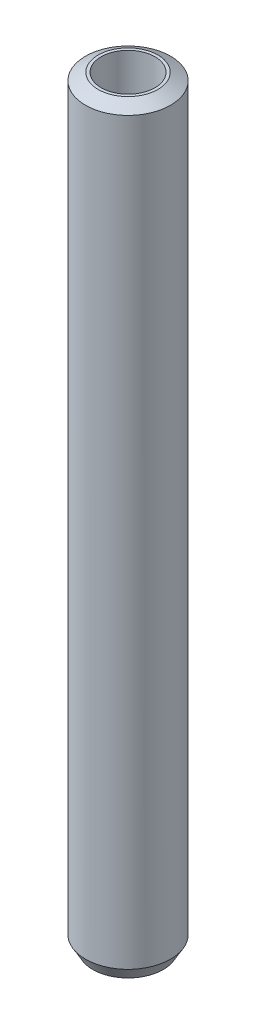
from build123d import *
from OCP.BRepFilletAPI import BRepFilletAPI_MakeChamfer

# Parameters (mm, degrees)
SKETCH1_R           = 25
BOSS_EXTRUDE1_DEPTH = 446.381429331
SKETCH2_R           = 15.813648109
CUT_EXTRUDE1_DEPTH  = 448.77938815
CHAMFER1_SIZE       = 4.301810032
CHAMFER1_SIZE2      = 7.450953539


with BuildPart() as part:
    # Sketch1 → Boss-Extrude1 (new body)
    with BuildSketch(Plane(origin=(0, 0, 0), x_dir=(1, 0, 0), z_dir=(0, 1, 0))):
        Circle(SKETCH1_R)
    extrude(amount=BOSS_EXTRUDE1_DEPTH)

    # Sketch2 → Cut-Extrude1 (cut, through all)
    with BuildSketch(Plane(origin=(0, 0, 0), x_dir=(1, 0, 0), z_dir=(0, 1, 0))):
        Circle(SKETCH2_R)
    extrude(amount=CUT_EXTRUDE1_DEPTH, mode=Mode.SUBTRACT)

    # Chamfer1: one chamfer whose edges measure the first distance from different faces: ONE call of the kernel's chamfer builder (chamfer() names one face for all edges)
    chamfer1_edges_1 = [part.edges().sort_by_distance(p)[0] for p in [
        (-25, 446.381429331, 0),
    ]]
    chamfer1_side_1 = [part.faces().sort_by_distance(p)[0] for p in [
        (-25, 223.190714666, 0),
    ]]
    chamfer1_edges_2 = [part.edges().sort_by_distance(p)[0] for p in [
        (-25, 0, 0),
    ]]
    chamfer1_side_2 = [part.faces().sort_by_distance(p)[0] for p in [
        (-24.292893219, 0, 0),
    ]]
    chamfer1 = BRepFilletAPI_MakeChamfer(part.part.solid().wrapped)
    for e in chamfer1_edges_1:
        chamfer1.Add(CHAMFER1_SIZE, CHAMFER1_SIZE2, e.wrapped, chamfer1_side_1[0].wrapped)  # the first distance lies on this face
    for e in chamfer1_edges_2:
        chamfer1.Add(CHAMFER1_SIZE, CHAMFER1_SIZE2, e.wrapped, chamfer1_side_2[0].wrapped)  # the first distance lies on this face
    add(Compound.cast(chamfer1.Shape()), mode=Mode.REPLACE)


solid = part.part
